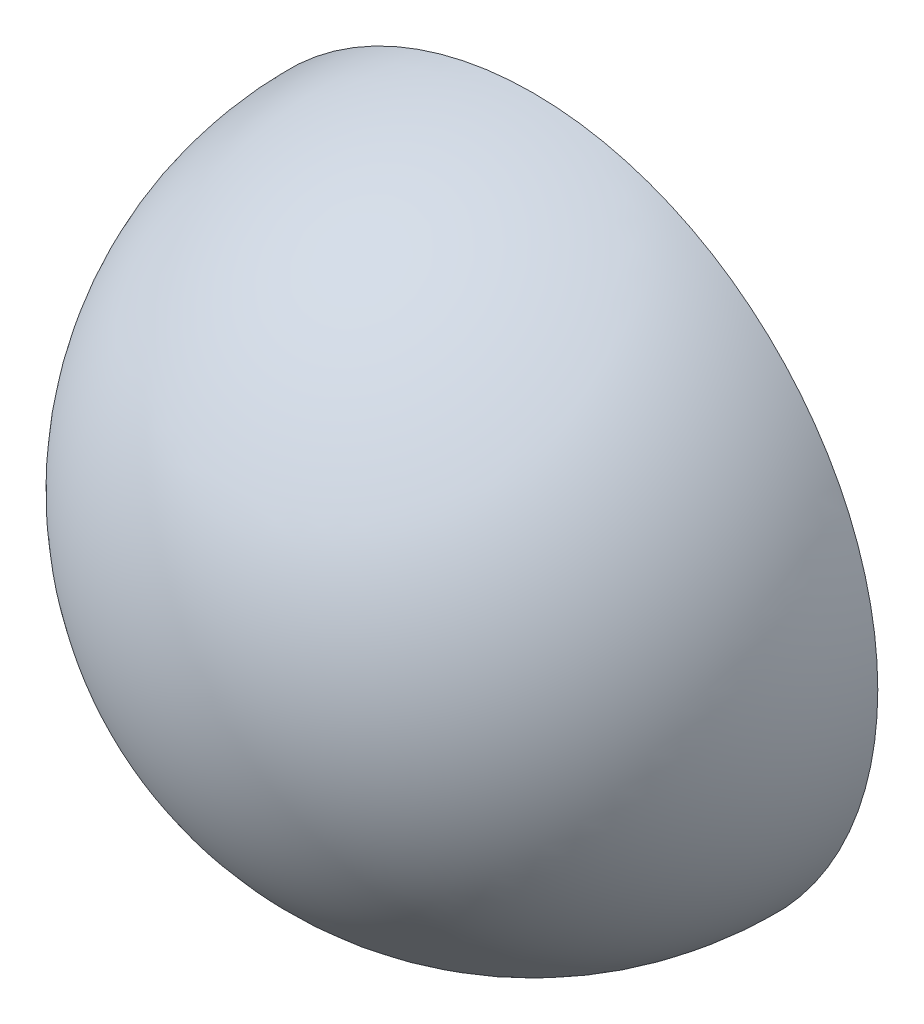
from build123d import *
from OCP.BRepFilletAPI import BRepFilletAPI_MakeChamfer

# Parameters (mm, degrees)
SKETCH2_R          = 2.5
CUT_EXTRUDE1_DEPTH = 5
CUT_EXTRUDE2_DEPTH = 5
CHAMFER2_SIZE      = 0.5
CHAMFER2_SIZE_2    = 1


with BuildPart() as part:
    # Sketch1 → Revolve1 (revolve)
    with BuildSketch(Plane(origin=(0, 0, 0), x_dir=(0, 0, -1), z_dir=(1, 0, 0))):
        with BuildLine():
            Line((0, 0), (0, -8.5))
            ThreePointArc((0, -8.5), (-6.01040764, -6.01040764), (-8.5, 0))
            Line((-8.5, 0), (0, 0))
        make_face()
    revolve(axis=Axis((0, 0, 0), (0, 0, 1)))

    # Sketch2 → Cut-Extrude1 (cut)
    with BuildSketch(Plane(origin=(0, 0, 0), x_dir=(-1, 0, 0), z_dir=(0, 0, -1))):
        with Locations(Location((0, 0, 0), (0, 0, 90))):
            Circle(SKETCH2_R)
    extrude(amount=-CUT_EXTRUDE1_DEPTH, mode=Mode.SUBTRACT)

    # Sketch3 → Cut-Extrude2 (cut)
    with BuildSketch(Plane(origin=(0, 0, 0), x_dir=(-1, 0, 0), z_dir=(0, 0, -1))):
        with BuildLine():
            ThreePointArc((-0.75, 2.90473751), (-1.5, 2.598076211), (-2.140576475, 2.101887808))
            Line((-2.140576475, 2.101887808), (-1.690338955, 1.841943055))
            ThreePointArc((-1.690338955, 1.841943055), (-1.25, 2.165063509), (-0.75, 2.384848004))
            Line((-0.75, 2.384848004), (-0.75, 2.90473751))
        make_face()
        with BuildLine():
            Line((1.690338955, 1.841943055), (2.140576475, 2.101887808))
            ThreePointArc((2.140576475, 2.101887808), (1.5, 2.598076211), (0.75, 2.90473751))
            Line((0.75, 2.90473751), (0.75, 2.384848004))
            ThreePointArc((0.75, 2.384848004), (1.25, 2.165063509), (1.690338955, 1.841943055))
        make_face()
        with BuildLine():
            Line((2.440338955, -0.542904949), (2.890576475, -0.802849702))
            ThreePointArc((2.890576475, -0.802849702), (2.972518244, -0.405136135), (3, 0))
            ThreePointArc((3, 0), (2.972518244, 0.405136135), (2.890576475, 0.802849702))
            Line((2.890576475, 0.802849702), (2.440338955, 0.542904949))
            ThreePointArc((2.440338955, 0.542904949), (2.485039978, 0.273086627), (2.5, 0))
            ThreePointArc((2.5, 0), (2.485039978, -0.273086627), (2.440338955, -0.542904949))
        make_face()
        with BuildLine():
            Line((0.75, -2.384848004), (0.75, -2.90473751))
            ThreePointArc((0.75, -2.90473751), (1.5, -2.598076211), (2.140576475, -2.101887808))
            Line((2.140576475, -2.101887808), (1.690338955, -1.841943055))
            ThreePointArc((1.690338955, -1.841943055), (1.25, -2.165063509), (0.75, -2.384848004))
        make_face()
        with BuildLine():
            ThreePointArc((-2.140576475, -2.101887808), (-1.5, -2.598076211), (-0.75, -2.90473751))
            Line((-0.75, -2.90473751), (-0.75, -2.384848004))
            ThreePointArc((-0.75, -2.384848004), (-1.25, -2.165063509), (-1.690338955, -1.841943055))
            Line((-1.690338955, -1.841943055), (-2.140576475, -2.101887808))
        make_face()
        with BuildLine():
            ThreePointArc((-2.890576475, 0.802849702), (-3, 0), (-2.890576475, -0.802849702))
            Line((-2.890576475, -0.802849702), (-2.440338955, -0.542904949))
            ThreePointArc((-2.440338955, -0.542904949), (-2.5, 0), (-2.440338955, 0.542904949))
            Line((-2.440338955, 0.542904949), (-2.890576475, 0.802849702))
        make_face()
    extrude(amount=-CUT_EXTRUDE2_DEPTH, mode=Mode.SUBTRACT)

    # Chamfer2
    chamfer2_edges_1 = [part.edges().sort_by_distance(p)[0] for p in [
        (-2.165063509, 1.25, 0),
    ]]
    chamfer2_side_1 = [part.faces().sort_by_distance(p)[0] for p in [
        (-2.173723763, 1.255, 0),
    ]]
    chamfer2_edges_2 = [part.edges().sort_by_distance(p)[0] for p in [
        (2.165063509, -1.25, 0),
    ]]
    chamfer2_side_2 = [part.faces().sort_by_distance(p)[0] for p in [
        (2.173723763, -1.255, 0),
    ]]
    chamfer2_edges_3 = [part.edges().sort_by_distance(p)[0] for p in [
        (0, 2.5, 0),
    ]]
    chamfer2_side_3 = [part.faces().sort_by_distance(p)[0] for p in [
        (0, 2.51, 0),
    ]]
    chamfer2_edges_4 = [part.edges().sort_by_distance(p)[0] for p in [
        (0, -2.5, 0),
    ]]
    chamfer2_side_4 = [part.faces().sort_by_distance(p)[0] for p in [
        (0, -2.51, 0),
    ]]
    chamfer2_edges_5 = [part.edges().sort_by_distance(p)[0] for p in [
        (2.165063509, 1.25, 0),
    ]]
    chamfer2_side_5 = [part.faces().sort_by_distance(p)[0] for p in [
        (2.173723763, 1.255, 0),
    ]]
    chamfer2_edges_6 = [part.edges().sort_by_distance(p)[0] for p in [
        (-2.165063509, -1.25, 0),
    ]]
    chamfer2_side_6 = [part.faces().sort_by_distance(p)[0] for p in [
        (-2.173723763, -1.255, 0),
    ]]
    chamfer2 = BRepFilletAPI_MakeChamfer(part.part.solid().wrapped)
    for e in chamfer2_edges_1:
        chamfer2.Add(CHAMFER2_SIZE - 0.0001, CHAMFER2_SIZE_2 - 0.0001, e.wrapped, chamfer2_side_1[0].wrapped)
    for e in chamfer2_edges_2:
        chamfer2.Add(CHAMFER2_SIZE - 0.0001, CHAMFER2_SIZE_2 - 0.0001, e.wrapped, chamfer2_side_2[0].wrapped)
    for e in chamfer2_edges_3:
        chamfer2.Add(CHAMFER2_SIZE - 0.0001, CHAMFER2_SIZE_2 - 0.0001, e.wrapped, chamfer2_side_3[0].wrapped)
    for e in chamfer2_edges_4:
        chamfer2.Add(CHAMFER2_SIZE - 0.0001, CHAMFER2_SIZE_2 - 0.0001, e.wrapped, chamfer2_side_4[0].wrapped)
    for e in chamfer2_edges_5:
        chamfer2.Add(CHAMFER2_SIZE - 0.0001, CHAMFER2_SIZE_2 - 0.0001, e.wrapped, chamfer2_side_5[0].wrapped)
    for e in chamfer2_edges_6:
        chamfer2.Add(CHAMFER2_SIZE - 0.0001, CHAMFER2_SIZE_2 - 0.0001, e.wrapped, chamfer2_side_6[0].wrapped)
    add(Compound.cast(chamfer2.Shape()), mode=Mode.REPLACE)  # a hair under: the kernel refuses the full size


solid = part.part
